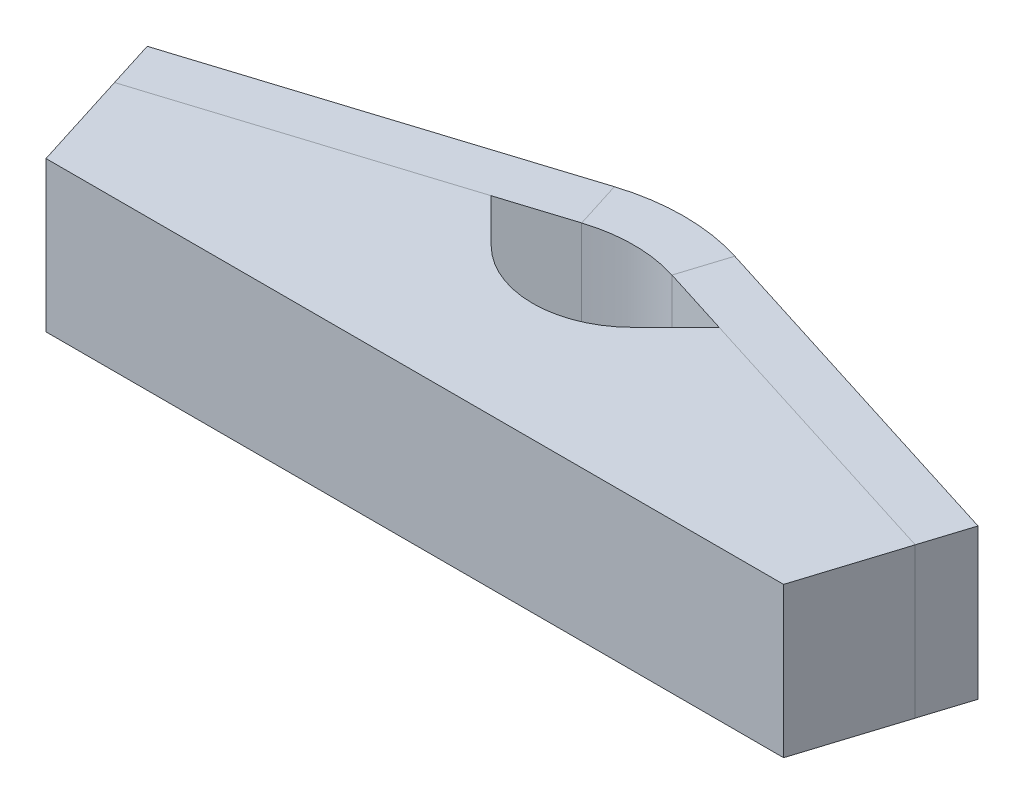
from build123d import *

# Parameters (mm, degrees)
BOSS_EXTRUDE1_DEPTH    = 4.7625
BOSS_EXTRUDE2_DEPTH    = 9.525
FILLET1_R              = 6.35
CONVERT_SOLID1_START   = -4.7625
CONVERT_SOLID1_DEPTH   = 9.525
CONVERT_SOLID1_2_DEPTH = 9.525


# Read off the part's stored shape, not the designer's step: Convert-Solid1
with BuildPart() as part:
    # Sketch1 → Boss-Extrude1 (new, symmetric)
    with BuildSketch(Plane(origin=(0, 0, 0), x_dir=(1, 0, 0), z_dir=(0, 1, 0))):
        Polygon((0, 3.329079972), (26.354740913, -4.980537919), (25.4, -8.008589238), (0, 0), (-25.4, -8.008589238), (-26.354740913, -4.980537919), align=None)
    extrude(amount=BOSS_EXTRUDE1_DEPTH, both=True)

    # Convert-Solid1 outline → Convert-Solid1 (cut)
    with BuildSketch(Plane(origin=(0, 0, 0), x_dir=(1, 0, 0), z_dir=(0, 1, 0)).offset(CONVERT_SOLID1_START)):
        with BuildLine():
            ThreePointArc((-3.818963654, 2.124965358), (0, 2.712760083), (3.818963654, 2.124965358))
            Line((3.818963654, 2.124965358), (0, 3.329079972))
            Line((0, 3.329079972), (-3.818963654, 2.124965358))
        make_face()
    extrude(amount=CONVERT_SOLID1_DEPTH, mode=Mode.SUBTRACT)

    # Convert-Solid1 2 outline → Convert-Solid1 2 (add)
    with BuildSketch(Plane(origin=(0, 0, 0), x_dir=(1, 0, 0), z_dir=(0, 1, 0)).offset(CONVERT_SOLID1_START)):
        with BuildLine():
            ThreePointArc((-2.86422274, -0.903085961), (0, -0.462239917), (2.86422274, -0.903085961))
            Line((2.86422274, -0.903085961), (0, 0))
            Line((0, 0), (-2.86422274, -0.903085961))
        make_face()
    extrude(amount=CONVERT_SOLID1_2_DEPTH)


with BuildPart() as body_2:
    # Sketch3 → Boss-Extrude2 (new body)
    with BuildSketch(Plane(origin=(0, 4.7625, 0), x_dir=(1, 0, 0), z_dir=(0, 1, 0))):
        Polygon((-25.4, -8.008589238), (-7.231692088, -2.280143757), (0, -9.511835845), (7.231692088, -2.280143757), (25.4, -8.008589238), (23.397852691, -14.358589238), (-23.397852691, -14.358589238), align=None)
    extrude(amount=-BOSS_EXTRUDE2_DEPTH)

    # Fillet1
    fillet1_edges = [body_2.edges().sort_by_distance(p)[0] for p in [
        (0, 0, 9.511835845),
    ]]
    fillet(fillet1_edges, radius=FILLET1_R)


solid = Compound([part.part, body_2.part])
